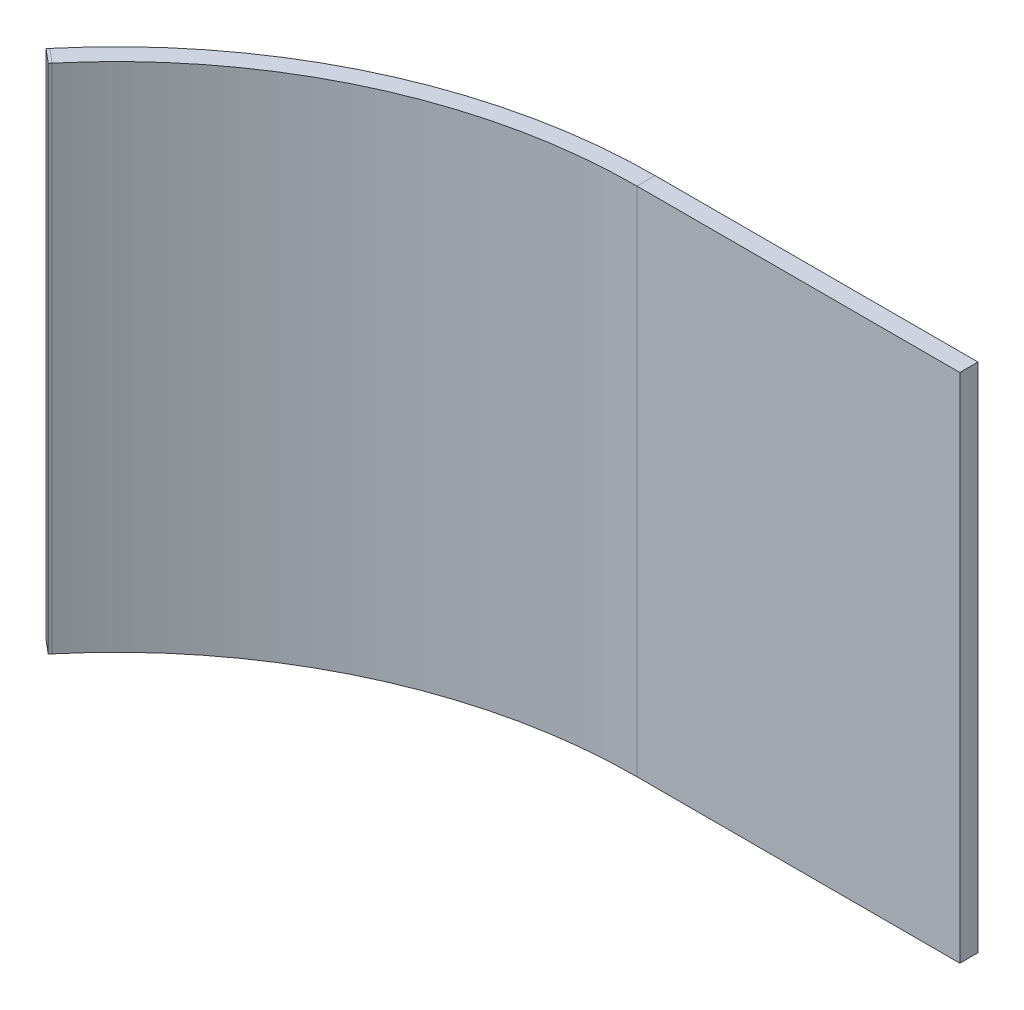
from build123d import *

# Parameters (mm, degrees)
SKETCH2_W          = 178
SKETCH2_H          = 282
BASE_FLANGE1_DEPTH = 10
EDGE_FLANGE2_DEPTH = 282


# Sheet-metal steps are written as plain solids
with BuildPart() as part:
    # Sketch2 → Base-Flange1 (new body)
    with BuildSketch(Plane.XY):
        Rectangle(SKETCH2_W, SKETCH2_H)
    extrude(amount=BASE_FLANGE1_DEPTH)

    # Edge-Flange2 section (across the edge) → Edge-Flange2 (add)
    with BuildSketch(Plane(origin=(-222.83029789, 141, 10), x_dir=(0.7660444431189746, 0, 0.6427876096865435), z_dir=(0, -1, 0))):
        with BuildLine():
            Line((-10, 133.83029789), (-10, 135.336923418))
            Line((-10, 135.336923418), (0, 135.336923418))
            Line((0, 135.336923418), (0, 133.83029789))
            ThreePointArc((0, 133.83029789), (26.88966512, 12.538856771), (102.51995602, -86.024457285))
            Line((102.51995602, -86.024457285), (96.092079923, -93.684901716))
            ThreePointArc((96.092079923, -93.684901716), (17.82658725, 8.312674153), (-10, 133.83029789))
        make_face()
    extrude(amount=EDGE_FLANGE2_DEPTH)


solid = part.part
